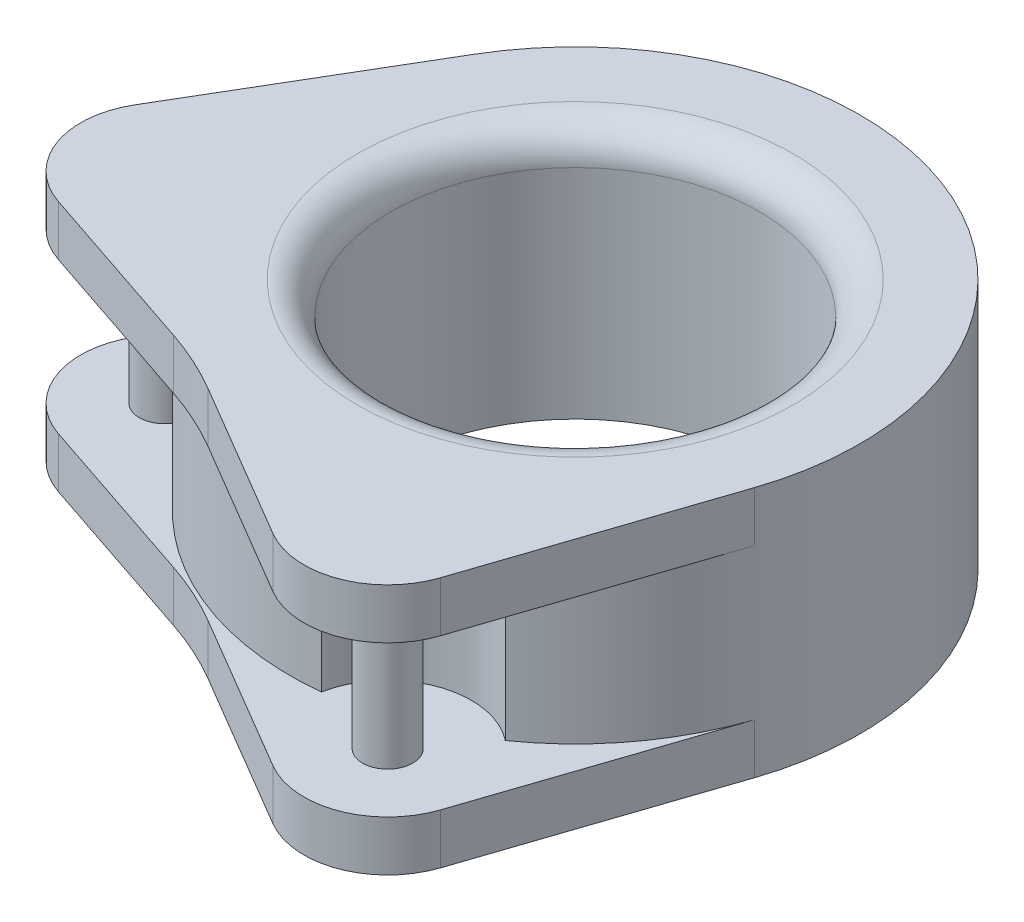
from build123d import *

# Parameters (mm, degrees)
SKETCH1_R               = 17
SKETCH1_R_2             = 11
BOSS_EXTRUDE1_DEPTH     = 15
BOSS_EXTRUDE2_START     = -15
BOSS_EXTRUDE2_DEPTH     = 15
FILLET1_R               = 5
CUT_EXTRUDE1_START      = -12
SKETCH3_R               = 1.5
CUT_EXTRUDE1_DEPTH      = 9
CIRPATTERN1_START       = 3
CIRPATTERN1_DEPTH       = 9
CIRPATTERN1_2_DEPTH     = 3
CIRPATTERN1_START_2     = 12
CIRPATTERN1_3_DEPTH     = 3
CIRPATTERN1_4_OUTLINE_R = 1.5
CIRPATTERN1_4_DEPTH     = 9
FILLET2_R               = 20
FILLET3_R               = 2


# Read off the part's stored shape, not the designer's step: CirPattern1
with BuildPart() as part:
    # Sketch1 → Boss-Extrude1 (new body)
    with BuildSketch(Plane(origin=(0, 0, 0), x_dir=(1, 0, 0), z_dir=(0, 1, 0))):
        with Locations(Location((0, 0, 0), (0, 0, 270))):
            Circle(SKETCH1_R)
        with Locations(Location((0, 0, 0), (0, 0, 270))):
            Circle(SKETCH1_R_2, mode=Mode.SUBTRACT)
    extrude(amount=BOSS_EXTRUDE1_DEPTH)

    # Sketch2 → Boss-Extrude2 (add)
    with BuildSketch(Plane(origin=(0, 15, 0), x_dir=(1, 0, 0), z_dir=(0, 1, 0)).offset(BOSS_EXTRUDE2_START)):
        with BuildLine():
            Line((-8.632611981, -14.645067784), (9.437831165, -25.296785229))
            Line((9.437831165, -25.296785229), (16.115556306, -5.411916938))
            ThreePointArc((16.115556306, -5.411916938), (5.942338141, -15.927605514), (-8.632611981, -14.645067784))
        make_face()
    extrude(amount=BOSS_EXTRUDE2_DEPTH)

    # Fillet1
    fillet1_edges = [part.edges().sort_by_distance(p)[0] for p in [
        (9.437831165, 7.5, 25.296785229),
    ]]
    fillet(fillet1_edges, radius=FILLET1_R)

    # Sketch3 → Cut-Extrude1 (cut)
    with BuildSketch(Plane(origin=(0, 15, 0), x_dir=(1, 0, 0), z_dir=(0, 1, 0)).offset(CUT_EXTRUDE1_START)):
        with BuildLine():
            ThreePointArc((1.752523284, -16.909425246), (-3.621565103, -16.609764183), (-8.632611981, -14.645067784))
            Line((-8.632611981, -14.645067784), (4.122994946, -22.163927157))
            ThreePointArc((4.122994946, -22.163927157), (8.409744981, -22.541144136), (11.401867971, -19.448294555))
            Line((11.401867971, -19.448294555), (16.115556306, -5.411916938))
            ThreePointArc((16.115556306, -5.411916938), (13.615928399, -10.178727515), (9.751380337, -13.925177971))
            ThreePointArc((9.751380337, -13.925177971), (4.914251957, -13.171964422), (1.752523284, -16.909425246))
        make_face()
        with Locations(Location((6.661998469, -17.856554279, 0), (0, 0, 270))):
            Circle(SKETCH3_R, mode=Mode.SUBTRACT)
    extrude(amount=CUT_EXTRUDE1_DEPTH, mode=Mode.SUBTRACT)

    # CirPattern1 outline → CirPattern1 (cut)
    with BuildSketch(Plane(origin=(0, 0, 0), x_dir=(1, 0, 0), z_dir=(0, 1, 0)).offset(CIRPATTERN1_START)):
        with BuildLine():
            ThreePointArc((-13.925177971, -9.751380337), (-13.171964422, -4.914251957), (-16.909425246, -1.752523284))
            ThreePointArc((-16.909425246, -1.752523284), (-15.927605515, -5.942338141), (-13.925177971, -9.751380337))
        make_face()
    extrude(amount=CIRPATTERN1_DEPTH, mode=Mode.SUBTRACT)

    # CirPattern1 2 outline → CirPattern1 2 (add)
    with BuildSketch(Plane(origin=(0, 0, 0), x_dir=(1, 0, 0), z_dir=(0, 1, 0))):
        with BuildLine():
            Line((-14.645067784, 8.632611981), (-22.163927157, -4.122994946))
            ThreePointArc((-22.163927157, -4.122994946), (-22.541144136, -8.409744981), (-19.448294555, -11.401867971))
            Line((-19.448294555, -11.401867971), (-7.099245913, -15.548918451))
            Line((-7.099245913, -15.548918451), (-8.632611981, -14.645067784))
            ThreePointArc((-8.632611981, -14.645067784), (-16.459805212, -4.25144827), (-14.645067784, 8.632611981))
        make_face()
    extrude(amount=CIRPATTERN1_2_DEPTH)

    # CirPattern1 3 outline → CirPattern1 3 (add)
    with BuildSketch(Plane(origin=(0, 0, 0), x_dir=(1, 0, 0), z_dir=(0, 1, 0)).offset(CIRPATTERN1_START_2)):
        with BuildLine():
            Line((-14.645067784, 8.632611981), (-22.163927157, -4.122994946))
            ThreePointArc((-22.163927157, -4.122994946), (-22.541144136, -8.409744981), (-19.448294555, -11.401867971))
            Line((-19.448294555, -11.401867971), (-7.099245913, -15.548918451))
            Line((-7.099245913, -15.548918451), (-8.632611981, -14.645067784))
            ThreePointArc((-8.632611981, -14.645067784), (-16.459805212, -4.25144827), (-14.645067784, 8.632611981))
        make_face()
    extrude(amount=CIRPATTERN1_3_DEPTH)

    # CirPattern1 4 outline → CirPattern1 4 (add)
    with BuildSketch(Plane(origin=(0, 0, 0), x_dir=(1, 0, 0), z_dir=(0, 1, 0)).offset(CIRPATTERN1_START)):
        with Locations((-17.856554279, -6.661998469)):
            Circle(CIRPATTERN1_4_OUTLINE_R)
    extrude(amount=CIRPATTERN1_4_DEPTH)

    # Fillet2
    fillet2_edges = [part.edges().sort_by_distance(p)[0] for p in [
        (-7.099245913, 13.5, 15.548918451),
        (-7.099245913, 1.5, 15.548918451),
    ]]
    fillet(fillet2_edges, radius=FILLET2_R)

    # Fillet3
    fillet3_edges = [part.edges().sort_by_distance(p)[0] for p in [
        (0, 15, -11),
    ]]
    fillet(fillet3_edges, radius=FILLET3_R)


solid = part.part
